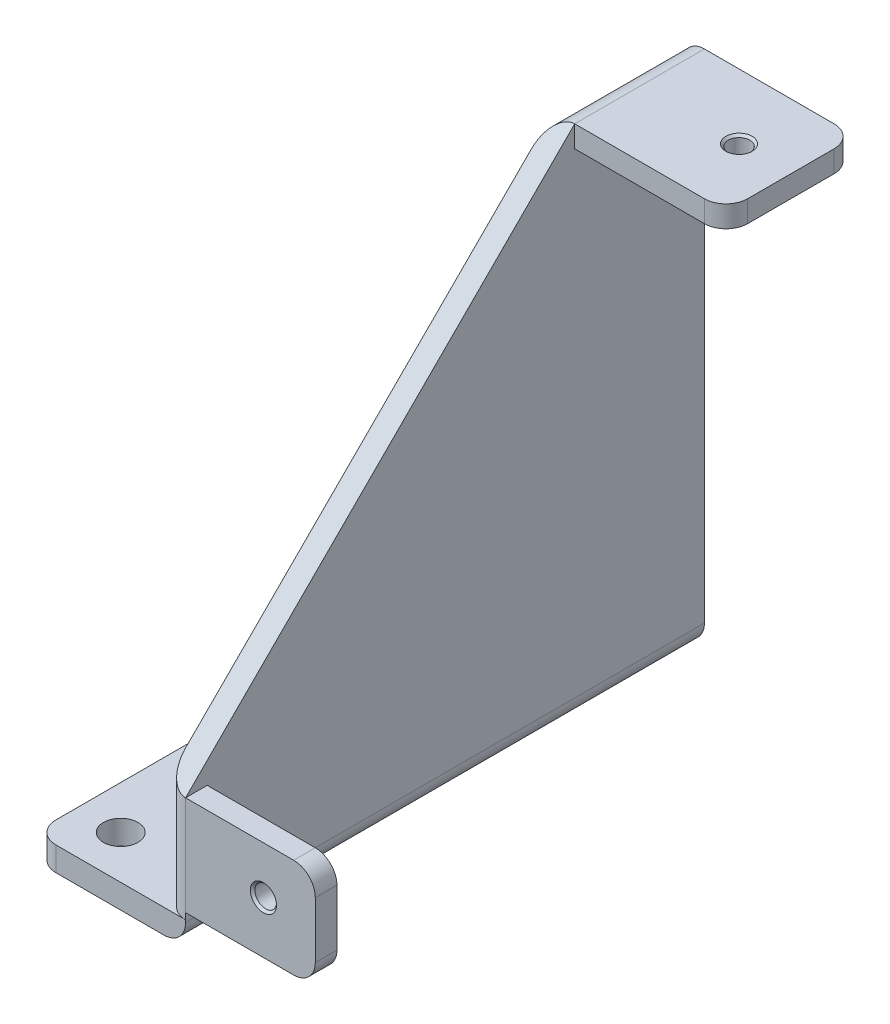
from build123d import *

# Parameters (mm, degrees)
ESTRUSIONE_ESTRUSIONE1_DEPTH    = 5
SCHIZZO2_W                      = 120
SCHIZZO2_H                      = 5.571316046
ESTRUSIONE_ESTRUSIONE2_DEPTH    = 30
SCHIZZO3_W                      = 5
SCHIZZO3_H                      = 23
ESTRUSIONE_ESTRUSIONE3_DEPTH    = 30
SCHIZZO4_W                      = 30
SCHIZZO4_H                      = 5
ESTRUSIONE_ESTRUSIONE4_DEPTH    = 35
RACCORDO1_R                     = 5
FORO_FILETTATO_M6_2_D           = 5
FORO_FILETTATO_M6_2_CSINK_D     = 6.05
FORO_FILETTATO_M6_2_CSINK_ANGLE = 90
FORO_FILETTATO_M6_3_D           = 5
FORO_FILETTATO_M6_3_CSINK_D     = 6.05
FORO_FILETTATO_M6_3_CSINK_ANGLE = 90
SCHIZZO13_R                     = 4
TAGLIO_ESTRUSIONE1_DEPTH        = 171.569410245


with BuildPart() as part:
    # Schizzo1 → Estrusione-Estrusione1 (new body)
    with BuildSketch(Plane(origin=(0, 0, 0), x_dir=(0, 0, -1), z_dir=(1, 0, 0))):
        Polygon((0, 0), (120, 0), (120, 120), (90, 120), (0, 30), align=None)
    extrude(amount=ESTRUSIONE_ESTRUSIONE1_DEPTH)

    # Schizzo2 → Estrusione-Estrusione2 (add)
    with BuildSketch(Plane.ZY):
        with Locations((-60, 2.785658023)):
            Rectangle(SCHIZZO2_W, SCHIZZO2_H)
    extrude(amount=ESTRUSIONE_ESTRUSIONE2_DEPTH)

    # Schizzo3 → Estrusione-Estrusione3 (add)
    with BuildSketch(Plane(origin=(5, 0, 0), x_dir=(0, 0, -1), z_dir=(1, 0, 0))):
        with Locations((2.5, 18.5)):
            Rectangle(SCHIZZO3_W, SCHIZZO3_H)
    extrude(amount=ESTRUSIONE_ESTRUSIONE3_DEPTH)

    # Schizzo4 → Estrusione-Estrusione4 (add)
    with BuildSketch(Plane(origin=(5, 0, 0), x_dir=(0, 0, -1), z_dir=(1, 0, 0))):
        with Locations((105, 117.5)):
            Rectangle(SCHIZZO4_W, SCHIZZO4_H)
    extrude(amount=ESTRUSIONE_ESTRUSIONE4_DEPTH)

    # Raccordo1
    # the kernel refuses this fillet: 5 mm, written as the material it takes off along each edge
    with BuildSketch(Plane(origin=(40, 102.5, -120), x_dir=(0, 0, 1), z_dir=(0, 1, 0)), Plane(origin=(35, 7, 12.5), x_dir=(0, 1, 0), z_dir=(0, 0, -1))) as raccordo1_piece_1:
        with BuildLine():
            CenterArc((RACCORDO1_R, -RACCORDO1_R), RACCORDO1_R, 90, 90)
            Line((0, -RACCORDO1_R), (0, 0))
            Line((0, 0), (RACCORDO1_R, 0))
        make_face()
    extrude(amount=30, mode=Mode.SUBTRACT)
    with BuildSketch(Plane(origin=(40, 132.5, -90), x_dir=(-1, 0, 0), z_dir=(0, -1, 0)), Plane(origin=(35, 30, -17.5), x_dir=(-1, 0, 0), z_dir=(0, 0, 1))) as raccordo1_piece_2:
        with BuildLine():
            CenterArc((RACCORDO1_R, RACCORDO1_R), RACCORDO1_R, 180, 90)
            Line((0, RACCORDO1_R), (0, 0))
            Line((0, 0), (RACCORDO1_R, 0))
        make_face()
    extrude(amount=30, mode=Mode.SUBTRACT)
    with BuildSketch(Plane(origin=(-30, 18.071316046, 0), x_dir=(0, 0, -1), z_dir=(0, -1, 0)), Plane(origin=(-30, -12.5, -120), x_dir=(0, 0, 1), z_dir=(0, 1, 0))) as raccordo1_piece_3:
        with BuildLine():
            CenterArc((RACCORDO1_R, RACCORDO1_R), RACCORDO1_R, 180, 90)
            Line((0, RACCORDO1_R), (0, 0))
            Line((0, 0), (RACCORDO1_R, 0))
        make_face()
    extrude(amount=30.571316046, mode=Mode.SUBTRACT)
    with BuildSketch(Plane(origin=(5, 0, 12.5), x_dir=(-1, 0, 0), z_dir=(0, 0, -1))) as raccordo1_piece_4:
        with BuildLine():
            CenterArc((RACCORDO1_R, RACCORDO1_R), RACCORDO1_R, 180, 90)
            Line((0, RACCORDO1_R), (0, 0))
            Line((0, 0), (RACCORDO1_R, 0))
        make_face()
    extrude(amount=145, mode=Mode.SUBTRACT)
    with BuildSketch(Plane(origin=(0, 120, -132.5), x_dir=(0, -1, 0), z_dir=(0, 0, 1))) as raccordo1_piece_5:
        with BuildLine():
            CenterArc((RACCORDO1_R, RACCORDO1_R), RACCORDO1_R, 180, 90)
            Line((0, RACCORDO1_R), (0, 0))
            Line((0, 0), (RACCORDO1_R, 0))
        make_face()
    extrude(amount=55, mode=Mode.SUBTRACT)
    with BuildSketch(Plane(origin=(0, 42.5, 0), x_dir=(0, 0, -1), z_dir=(0, -1, 0))) as raccordo1_piece_6:
        with BuildLine():
            CenterArc((RACCORDO1_R, RACCORDO1_R), RACCORDO1_R, 180, 90)
            Line((0, RACCORDO1_R), (0, 0))
            Line((0, 0), (RACCORDO1_R, 0))
        make_face()
    extrude(amount=36.928683954, mode=Mode.SUBTRACT)

    # Foro filettato M6-2 (through all)
    with Locations(Plane(origin=(0, 120, 0), x_dir=(1, 0, 0), z_dir=(0, 1, 0))):
        with Locations((28, 105)):
            CounterSinkHole(FORO_FILETTATO_M6_2_D / 2, FORO_FILETTATO_M6_2_CSINK_D / 2, counter_sink_angle=FORO_FILETTATO_M6_2_CSINK_ANGLE)

    # Foro filettato M6-3 (through all)
    with Locations(Plane.XY):
        with Locations((23, 19)):
            CounterSinkHole(FORO_FILETTATO_M6_3_D / 2, FORO_FILETTATO_M6_3_CSINK_D / 2, counter_sink_angle=FORO_FILETTATO_M6_3_CSINK_ANGLE)

    # Schizzo13 → Taglio-Estrusione1 (cut, through all)
    with BuildSketch(Plane(origin=(0, 5.571316046, 0), x_dir=(1, 0, 0), z_dir=(0, 1, 0))):
        with Locations(Location((-20, 110, 0), (0, 0, 270))):
            Circle(SCHIZZO13_R)
        with Locations(Location((-20, 10, 0), (0, 0, 270))):
            Circle(SCHIZZO13_R)
    extrude(amount=-TAGLIO_ESTRUSIONE1_DEPTH, mode=Mode.SUBTRACT)


solid = part.part
